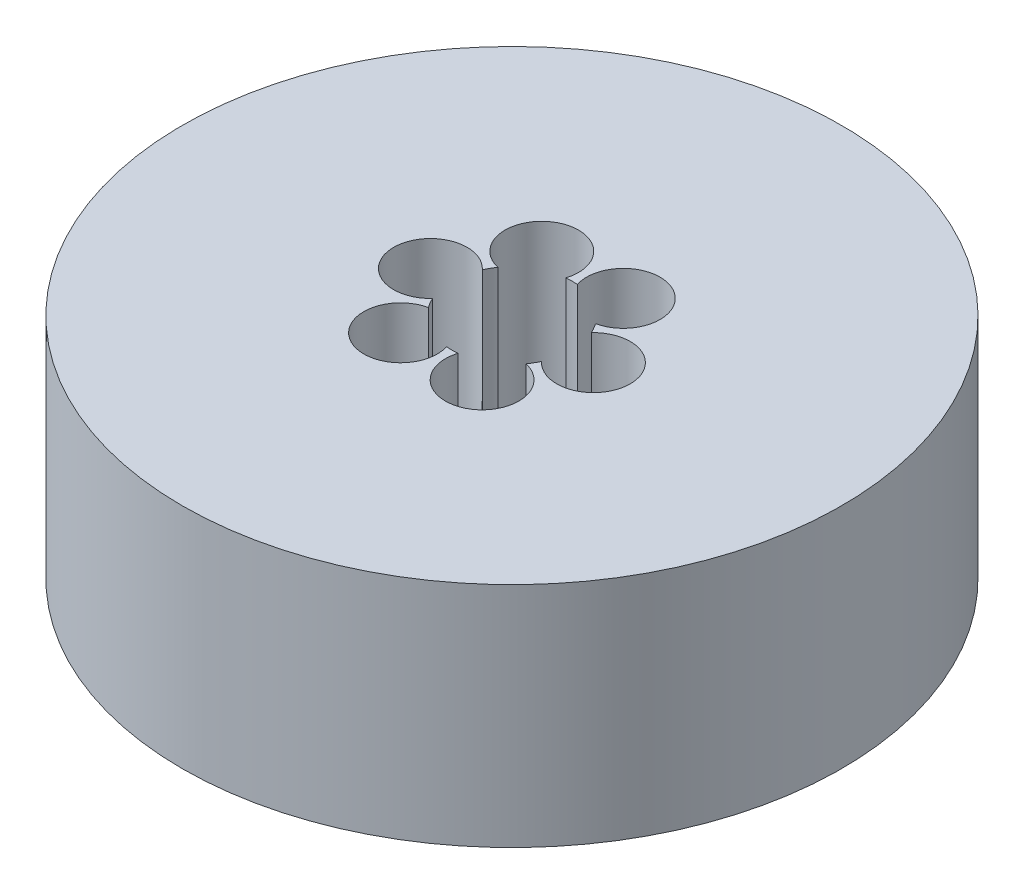
from build123d import *

# Parameters (mm, degrees)
SKETCH1_R           = 27.5
BOSS_EXTRUDE1_DEPTH = 19
SKETCH2_R           = 5
CUT_EXTRUDE1_DEPTH  = 44.283946216
SKETCH3_R           = 3.06638387
CUT_EXTRUDE2_DEPTH  = 16.231051748
CIRPATTERN1_COUNT   = 6


with BuildPart() as part:
    # Sketch1 → Boss-Extrude1 (new body)
    with BuildSketch(Plane(origin=(0, 0, 0), x_dir=(1, 0, 0), z_dir=(0, 1, 0))):
        Circle(SKETCH1_R)
    extrude(amount=BOSS_EXTRUDE1_DEPTH)

    # Sketch2 → Cut-Extrude1 (cut, through all)
    with BuildSketch(Plane(origin=(0, 0, 0), x_dir=(1, 0, 0), z_dir=(0, 1, 0))):
        Circle(SKETCH2_R)
    extrude(amount=CUT_EXTRUDE1_DEPTH, mode=Mode.SUBTRACT)

    # Sketch3 → Cut-Extrude2 (cut)
    with BuildSketch(Plane(origin=(0, 19, 0), x_dir=(1, 0, 0), z_dir=(0, 1, 0))):
        with Locations((-6.803242823, 0)):
            Circle(SKETCH3_R)
    cut_extrude2 = extrude(amount=-CUT_EXTRUDE2_DEPTH, mode=Mode.SUBTRACT)

    # CirPattern1: Cut-Extrude2 ×6 about axis
    cirpattern1_axis = Axis((0, 0, 0), (0, 1, 0))
    for i in range(1, CIRPATTERN1_COUNT):
        add(cut_extrude2.rotate(cirpattern1_axis, i * 360 / CIRPATTERN1_COUNT), mode=Mode.SUBTRACT)


solid = part.part
